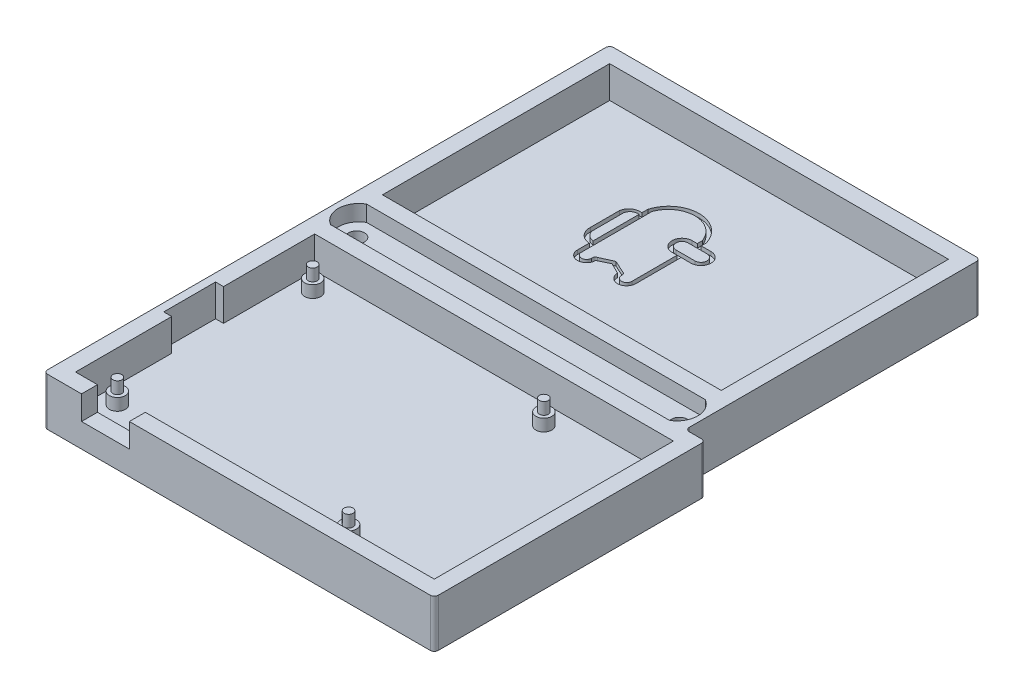
from build123d import *

# Parameters (mm, degrees)
SKETCH1_3_W         = 93
SKETCH1_3_H         = 65
SKETCH1_3_W_2       = 85
SKETCH1_3_H_2       = 57
BOSS_EXTRUDE1_DEPTH = 8
SKETCH1_W           = 70
SKETCH1_H           = 53
BOSS_EXTRUDE2_DEPTH = 8
SKETCH1_5_W         = 93
SKETCH1_5_H         = 9
BOSS_EXTRUDE3_DEPTH = 8
SKETCH2_W           = 85
SKETCH2_H           = 9
CUT_EXTRUDE1_DEPTH  = 4
CUT_EXTRUDE3_DEPTH  = 10
CUT_EXTRUDE4_DEPTH  = 9
SKETCH3_4_R         = 2
CUT_EXTRUDE5_DEPTH  = 9
BOSS_EXTRUDE4_DEPTH = 8
SKETCH8_W           = 102.657950831
SKETCH8_H           = 62.680984877
CUT_EXTRUDE8_DEPTH  = 10
BOSS_EXTRUDE5_DEPTH = 8
SKETCH11_W          = 12
SKETCH11_H          = 6
CUT_EXTRUDE9_DEPTH  = 8
SKETCH12_R          = 2
BOSS_EXTRUDE6_DEPTH = 4
SKETCH13_R          = 1.125
BOSS_EXTRUDE7_DEPTH = 6
SKETCH14_R          = 2
BOSS_EXTRUDE8_DEPTH = 3
FILLET1_R           = 1
FILLET2_R           = 1
SKETCH17_W          = 2
SKETCH17_H          = 13
CUT_EXTRUDE10_DEPTH = 8
CUT_EXTRUDE13_DEPTH = 1


with BuildPart() as part:
    # Sketch1<3> → Boss-Extrude1 (new body)
    with BuildSketch(Plane(origin=(0, 0, 0), x_dir=(1, 0, 0), z_dir=(0, 1, 0))):
        with Locations((-14.774509804, 34.22139079)):
            Rectangle(SKETCH1_3_W, SKETCH1_3_H)
        with Locations((-14.774509804, 34.22139079)):
            Rectangle(SKETCH1_3_W_2, SKETCH1_3_H_2, mode=Mode.SUBTRACT)
    extrude(amount=BOSS_EXTRUDE1_DEPTH)



with BuildPart() as body_2:
    # Sketch1 → Boss-Extrude2 (new body)
    with BuildSketch(Plane(origin=(0, 0, 0), x_dir=(1, 0, 0), z_dir=(0, 1, 0))):
        Polygon((31.725490196, -7.27860921), (-61.274509804, -7.27860921), (-61.274509804, -68.27860921), (16.725490196, -68.27860921), (16.725490196, -11.27860921), (31.725490196, -11.27860921), align=None)
        with Locations((-22.274509804, -37.77860921)):
            Rectangle(SKETCH1_W, SKETCH1_H, mode=Mode.SUBTRACT)
    extrude(amount=BOSS_EXTRUDE2_DEPTH)


with BuildPart() as part_1:
    add(part.part)

    add(body_2.part)  # Boss-Extrude3 merges body 2
    # Sketch1<5> → Boss-Extrude3 (add)
    with BuildSketch(Plane(origin=(0, 0, 0), x_dir=(1, 0, 0), z_dir=(0, 1, 0))):
        with Locations((-14.774509804, -2.77860921)):
            Rectangle(SKETCH1_5_W, SKETCH1_5_H)
    extrude(amount=BOSS_EXTRUDE3_DEPTH)

    # Sketch2 → Cut-Extrude1 (cut)
    with BuildSketch(Plane(origin=(0, 8, 0), x_dir=(1, 0, 0), z_dir=(0, 1, 0))):
        with Locations((-14.774509804, -2.77860921)):
            Rectangle(SKETCH2_W, SKETCH2_H)
    extrude(amount=-CUT_EXTRUDE1_DEPTH, mode=Mode.SUBTRACT)

    # Sketch3 → Cut-Extrude3 (cut)
    with BuildSketch(Plane(origin=(0, 4, 0), x_dir=(1, 0, 0), z_dir=(0, 1, 0))):
        with BuildLine():
            Line((-57.274509804, 1.72139079), (-57.274509804, -7.27860921))
            ThreePointArc((-57.274509804, -7.27860921), (-59.872586015, -2.77860921), (-57.274509804, 1.72139079))
        make_face()
    extrude(amount=CUT_EXTRUDE3_DEPTH, mode=Mode.SUBTRACT)

    # Sketch3<3> → Cut-Extrude4 (cut)
    with BuildSketch(Plane(origin=(0, 4, 0), x_dir=(1, 0, 0), z_dir=(0, 1, 0))):
        with BuildLine():
            Line((27.725490196, 1.72139079), (27.725490196, -7.27860921))
            ThreePointArc((27.725490196, -7.27860921), (30.323566407, -2.77860921), (27.725490196, 1.72139079))
        make_face()
    extrude(amount=CUT_EXTRUDE4_DEPTH, mode=Mode.SUBTRACT)

    # Sketch3<4> → Cut-Extrude5 (cut)
    with BuildSketch(Plane(origin=(0, 4, 0), x_dir=(1, 0, 0), z_dir=(0, 1, 0))):
        with Locations((-55.274509804, -2.77860921)):
            Circle(SKETCH3_4_R)
        with Locations((25.725490196, -2.77860921)):
            Circle(SKETCH3_4_R)
    extrude(amount=-CUT_EXTRUDE5_DEPTH, mode=Mode.SUBTRACT)

    # Sketch5 → Boss-Extrude4 (add)
    with BuildSketch(Plane(origin=(0, 8, 0), x_dir=(1, 0, 0), z_dir=(0, 1, 0))):
        Polygon((9.293169663, -21.413968145), (12.725490196, -24.846288677), (12.725490196, -11.27860921), (9.293169663, -11.27860921), align=None)
        Polygon((9.293169663, -62.27860921), (9.293169663, -64.27860921), (12.725490196, -64.27860921), (12.725490196, -58.846288677), align=None)
    extrude(amount=-BOSS_EXTRUDE4_DEPTH)

    # Sketch8 → Cut-Extrude8 (cut)
    with BuildSketch(Plane(origin=(0, 8, 0), x_dir=(1, 0, 0), z_dir=(0, 1, 0))):
        with Locations((-19.237898971, -42.619101648)):
            Rectangle(SKETCH8_W, SKETCH8_H)
    extrude(amount=-CUT_EXTRUDE8_DEPTH, mode=Mode.SUBTRACT)

    # Sketch10 → Boss-Extrude5 (add)
    with BuildSketch(Plane.XZ):
        Polygon((-61.274509804, 75.27860921), (-61.274509804, 11.27860921), (-57.274509804, 11.27860921), (-57.274509804, 71.27860921), (32.725490196, 71.27860921), (32.725490196, 11.27860921), (31.725490196, 11.27860921), (31.725490196, 7.27860921), (36.725490196, 7.27860921), (36.725490196, 75.27860921), align=None)
    extrude(amount=-BOSS_EXTRUDE5_DEPTH)

    # Sketch11 → Cut-Extrude9 (cut)
    with BuildSketch(Plane.XY.offset(75.27860921)):
        with Locations((-45.774509804, 5)):
            Rectangle(SKETCH11_W, SKETCH11_H)
    extrude(amount=-CUT_EXTRUDE9_DEPTH, mode=Mode.SUBTRACT)

    # Sketch12 → Boss-Extrude6 (add)
    with BuildSketch(Plane.XZ):
        Polygon((36.725490196, 75.27860921), (-61.274509804, 75.27860921), (-61.274509804, -66.72139079), (31.725490196, -66.72139079), (31.725490196, 7.27860921), (36.725490196, 7.27860921), align=None)
        with Locations((25.725490196, 2.77860921)):
            Circle(SKETCH12_R, mode=Mode.SUBTRACT)
        with Locations((-55.274509804, 2.77860921)):
            Circle(SKETCH12_R, mode=Mode.SUBTRACT)
    extrude(amount=BOSS_EXTRUDE6_DEPTH)

    # Sketch13 → Boss-Extrude7 (add)
    with BuildSketch(Plane(origin=(0, 0, 0), x_dir=(1, 0, 0), z_dir=(0, 1, 0))):
        with Locations((-52.899509804, -65.15360921)):
            Circle(SKETCH13_R)
        with Locations((-52.899509804, -16.15360921)):
            Circle(SKETCH13_R)
        with Locations((5.100490196, -65.15360921)):
            Circle(SKETCH13_R)
        with Locations((5.100490196, -16.15360921)):
            Circle(SKETCH13_R)
    extrude(amount=BOSS_EXTRUDE7_DEPTH)

    # Sketch14 → Boss-Extrude8 (add)
    with BuildSketch(Plane(origin=(0, 0, 0), x_dir=(1, 0, 0), z_dir=(0, 1, 0))):
        with Locations((-52.899509804, -16.15360921)):
            Circle(SKETCH14_R)
        with Locations((-52.899509804, -65.15360921)):
            Circle(SKETCH14_R)
        with Locations((5.100490196, -16.15360921)):
            Circle(SKETCH14_R)
        with Locations((5.100490196, -65.15360921)):
            Circle(SKETCH14_R)
    extrude(amount=BOSS_EXTRUDE8_DEPTH)

    # Fillet1
    fillet1_edges = [part_1.edges().sort_by_distance(p)[0] for p in [
        (-61.274509804, 2, -66.72139079),
        (31.725490196, 2, -66.72139079),
        (36.725490196, 2, 7.27860921),
        (36.725490196, 2, 75.27860921),
        (-61.274509804, 2, 75.27860921),
    ]]
    fillet(fillet1_edges, radius=FILLET1_R)

    # Fillet2
    fillet2_edges = [part_1.edges().sort_by_distance(p)[0] for p in [
        (31.725490196, 2, 7.27860921),
    ]]
    fillet(fillet2_edges, radius=FILLET2_R)

    # Sketch17 → Cut-Extrude10 (cut)
    with BuildSketch(Plane(origin=(0, 8, 0), x_dir=(1, 0, 0), z_dir=(0, 1, 0))):
        with Locations((-58.274509804, -40.65360921)):
            Rectangle(SKETCH17_W, SKETCH17_H)
    extrude(amount=-CUT_EXTRUDE10_DEPTH, mode=Mode.SUBTRACT)

    # Sketch19 → Cut-Extrude13 (cut)
    with BuildSketch(Plane(origin=(0, 0, 0), x_dir=(1, 0, 0), z_dir=(0, 1, 0))):
        with BuildLine():
            ThreePointArc((-14.187240253, 43.873456714), (-21.513522843, 49.386018617), (-28.839805433, 43.873456714))
            Line((-28.839805433, 43.873456714), (-28.839805433, 42.352676588))
            ThreePointArc((-28.839805433, 42.352676588), (-30.946377045, 41.898071528), (-32.114493798, 40.087046136))
            Line((-32.114493798, 40.087046136), (-32.114493798, 32.704407352))
            ThreePointArc((-32.114493798, 32.704407352), (-31.20914902, 30.258994294), (-28.839805433, 29.170001569))
            Line((-28.839805433, 29.170001569), (-28.839805433, 26.200897185))
            ThreePointArc((-28.839805433, 26.200897185), (-26.54684676, 23.907938511), (-24.253888086, 26.200897185))
            Line((-24.253888086, 26.200897185), (-21.513522843, 27.543116896))
            Line((-21.513522843, 27.543116896), (-18.773157601, 26.200897185))
            ThreePointArc((-18.773157601, 26.200897185), (-16.480198927, 23.907938511), (-14.187240253, 26.200897185))
            Line((-14.187240253, 26.200897185), (-14.187240253, 37.563243526))
            Line((-14.187240253, 37.563243526), (-11.731724595, 37.563243526))
            ThreePointArc((-11.731724595, 37.563243526), (-9.207921985, 40.087046136), (-11.731724595, 42.610848746))
            Line((-11.731724595, 42.610848746), (-14.187240253, 42.610848746))
            Line((-14.187240253, 42.610848746), (-14.187240253, 43.873456714))
        make_face()
        with BuildLine():
            Line((-28.839805433, 41.651053984), (-28.839805433, 30.169398393))
            ThreePointArc((-28.839805433, 30.169398393), (-30.502167161, 30.965799487), (-31.114493798, 32.704407352))
            Line((-31.114493798, 32.704407352), (-31.114493798, 40.087046136))
            ThreePointArc((-31.114493798, 40.087046136), (-30.301066246, 41.340153445), (-28.839805433, 41.651053984))
        make_face(mode=Mode.SUBTRACT)
        with BuildLine():
            Line((-27.839805433, 26.200897185), (-27.839805433, 43.873456714))
            ThreePointArc((-27.839805433, 43.873456714), (-21.513522843, 48.356344828), (-15.187240253, 43.873456714))
            Line((-15.187240253, 43.873456714), (-15.187240253, 42.610848746))
            Line((-15.187240253, 42.610848746), (-16.480198927, 42.610848746))
            ThreePointArc((-16.480198927, 42.610848746), (-19.004001537, 40.087046136), (-16.480198927, 37.563243526))
            Line((-16.480198927, 37.563243526), (-15.187240253, 37.563243526))
            Line((-15.187240253, 37.563243526), (-15.187240253, 26.200897185))
            ThreePointArc((-15.187240253, 26.200897185), (-16.480198927, 24.907938511), (-17.773157601, 26.200897185))
            ThreePointArc((-17.773157601, 26.200897185), (-17.872818841, 26.761006886), (-18.339347349, 27.086593116))
            Line((-18.339347349, 27.086593116), (-21.513522843, 28.543116896))
            Line((-21.513522843, 28.543116896), (-24.693755535, 27.098959893))
            ThreePointArc((-24.693755535, 27.098959893), (-25.159816688, 26.765935788), (-25.253888086, 26.200897185))
            ThreePointArc((-25.253888086, 26.200897185), (-26.54684676, 24.907938511), (-27.839805433, 26.200897185))
        make_face(mode=Mode.SUBTRACT)
        with BuildLine():
            ThreePointArc((-16.480198927, 38.563243526), (-18.004001537, 40.087046136), (-16.480198927, 41.610848746))
            Line((-16.480198927, 41.610848746), (-11.731724595, 41.610848746))
            ThreePointArc((-11.731724595, 41.610848746), (-10.207921985, 40.087046136), (-11.731724595, 38.563243526))
            Line((-11.731724595, 38.563243526), (-16.480198927, 38.563243526))
        make_face(mode=Mode.SUBTRACT)
    extrude(amount=-CUT_EXTRUDE13_DEPTH, mode=Mode.SUBTRACT)


solid = part_1.part
